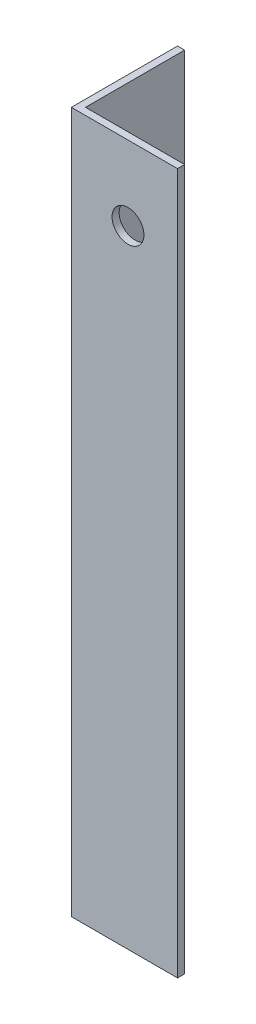
from build123d import *

# Parameters (mm, degrees)
EXTRUDE_1_DEPTH     = 99
SKETCH_2_R          = 2.25
CUT_EXTRUDE_1_DEPTH = 102.103906947


with BuildPart() as part:
    # Эскиз1 → Бобышка-Вытянуть1 (new body)
    with BuildSketch(Plane(origin=(0, 0, 0), x_dir=(1, 0, 0), z_dir=(0, 1, 0))):
        Polygon((0, 0), (0, 15), (1, 15), (1, 1), (15, 1), (15, 0), align=None)
    extrude(amount=EXTRUDE_1_DEPTH)

    # Эскиз2 → Вырез-Вытянуть1 (cut, through all)
    with BuildSketch(Plane(origin=(0, 0, -1), x_dir=(-1, 0, 0), z_dir=(0, 0, -1))):
        with Locations((-8, 88.5)):
            Circle(SKETCH_2_R)
    extrude(amount=-CUT_EXTRUDE_1_DEPTH, mode=Mode.SUBTRACT)


solid = part.part
